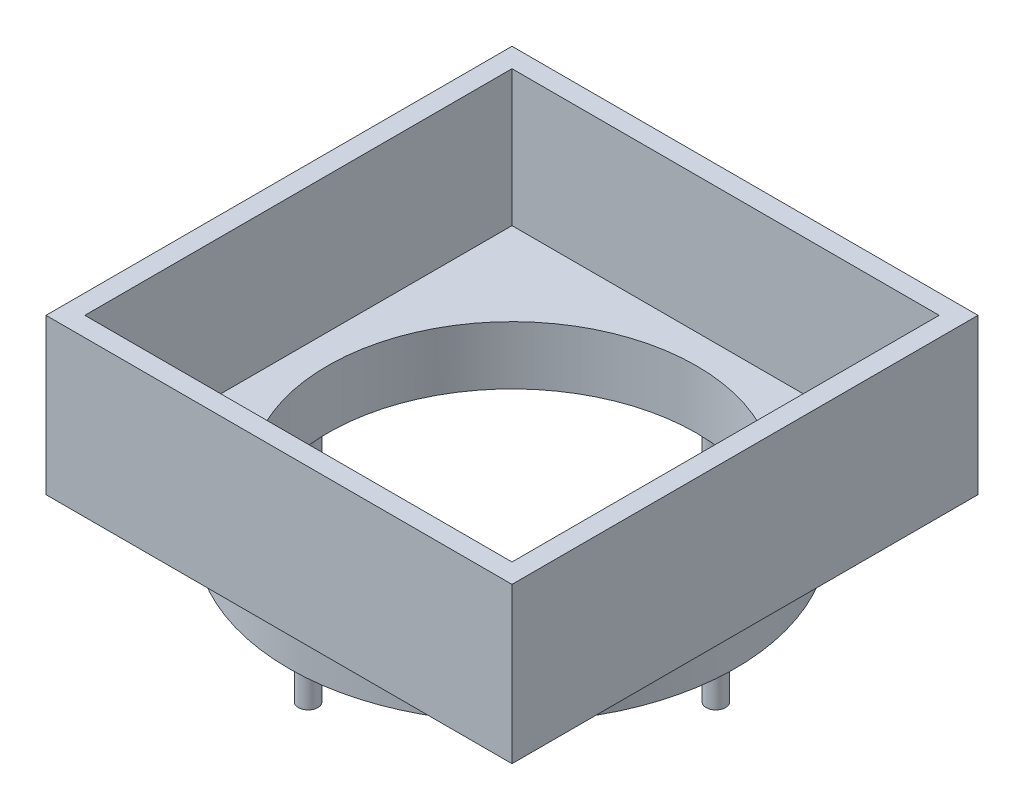
from build123d import *

# Parameters (mm, degrees)
ESQUISSE1_R             = 57.5
ESQUISSE1_R_2           = 47.5
BOSS_EXTRU_1_DEPTH      = 10
ESQUISSE3_R             = 2.5
BOSS_EXTRU_2_DEPTH      = 10
ESQUISSE10_W            = 120
ESQUISSE10_H            = 120
BOSS_EXTRU_3_DEPTH      = 40
COQUE1_START            = 15
COQUE1_OUTLINE_W        = 110
COQUE1_OUTLINE_H        = 110
COQUE1_DEPTH            = 35
ESQUISSE14_R            = 47.5
ENL_V_MAT_EXTRU_1_DEPTH = 40


# Read off the part's stored shape, not the designer's step: Coque1
with BuildPart() as part:
    # Esquisse1 → Boss.-Extru.1 (new body)
    with BuildSketch(Plane(origin=(0, 0, 0), x_dir=(1, 0, 0), z_dir=(0, 1, 0))):
        with Locations(Location((0, 0, 0), (0, 0, 270))):
            Circle(ESQUISSE1_R)
        with Locations(Location((0, 0, 0), (0, 0, 270))):
            Circle(ESQUISSE1_R_2, mode=Mode.SUBTRACT)
    extrude(amount=BOSS_EXTRU_1_DEPTH)

    # Esquisse3 → Boss.-Extru.2 (add)
    with BuildSketch(Plane(origin=(0, 0, 0), x_dir=(1, 0, 0), z_dir=(0, 1, 0))):
        with Locations(Location((0, 52.5, 0), (0, 0, 270))):
            Circle(ESQUISSE3_R)
        with Locations(Location((0, -52.5, 0), (0, 0, 270))):
            Circle(ESQUISSE3_R)
        with Locations(Location((52.5, 0, 0), (0, 0, 270))):
            Circle(ESQUISSE3_R)
        with Locations(Location((-52.5, 0, 0), (0, 0, 270))):
            Circle(ESQUISSE3_R)
    extrude(amount=-BOSS_EXTRU_2_DEPTH)

    # Esquisse10 → Boss.-Extru.3 (add)
    with BuildSketch(Plane(origin=(0, 10, 0), x_dir=(1, 0, 0), z_dir=(0, 1, 0))):
        Rectangle(ESQUISSE10_W, ESQUISSE10_H)
    extrude(amount=BOSS_EXTRU_3_DEPTH)

    # Coque1 outline → Coque1 (cut)
    with BuildSketch(Plane(origin=(0, 0, 0), x_dir=(1, 0, 0), z_dir=(0, 1, 0)).offset(COQUE1_START)):
        Rectangle(COQUE1_OUTLINE_W, COQUE1_OUTLINE_H)
    extrude(amount=COQUE1_DEPTH, mode=Mode.SUBTRACT)

    # Esquisse14 → Enlèv. mat.-Extru.1 (cut)
    with BuildSketch(Plane.XZ.offset(-10)):
        with Locations(Location((0, 0, 0), (0, 0, 270))):
            Circle(ESQUISSE14_R)
    extrude(amount=-ENL_V_MAT_EXTRU_1_DEPTH, mode=Mode.SUBTRACT)


solid = part.part
